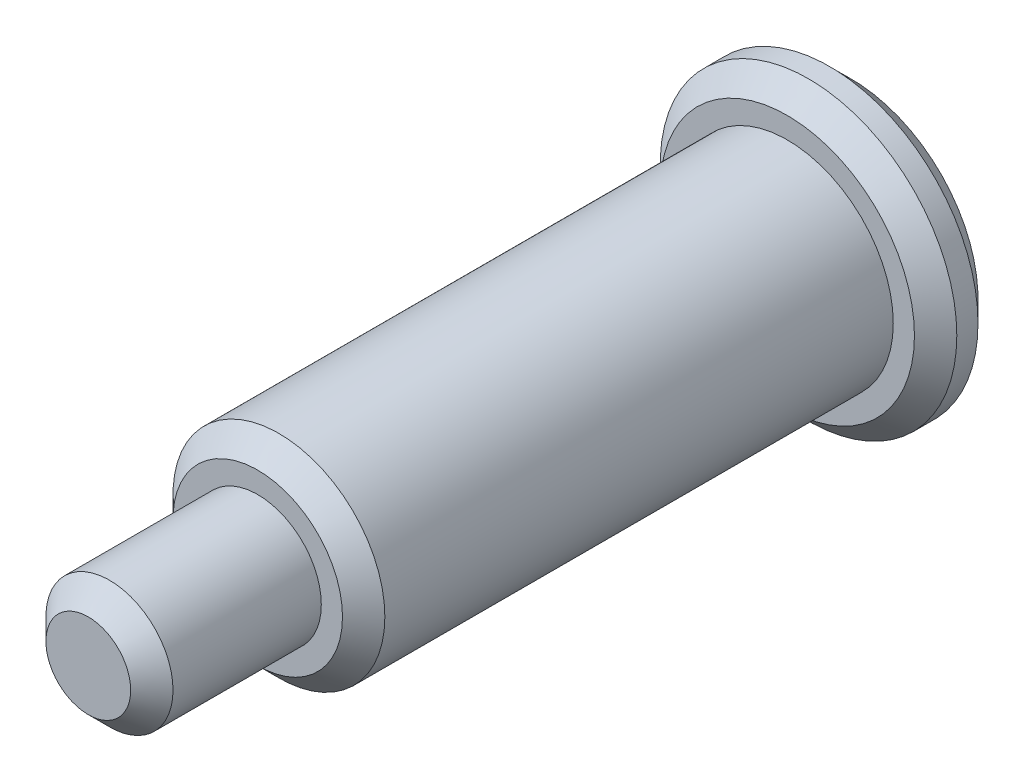
from build123d import *

# Parameters (mm, degrees)
CHAMFER1_SIZE = 1


with BuildPart() as part:
    # Sketch1 → Revolve1 (revolve)
    with BuildSketch(Plane(origin=(0, 0, 0), x_dir=(1, 0, 0), z_dir=(0, 1, 0))):
        Polygon((0, 0), (7, 0), (7, -3), (5, -3), (5, -28), (3, -28), (3, -36), (0, -36), align=None)
    revolve(axis=Axis((0, 0, 36), (0, 0, -1)))

    # Chamfer1
    chamfer1_edges = [part.edges().sort_by_distance(p)[0] for p in [
        (-3, 0, 36),
        (-5, 0, 28),
        (-7, 0, 0),
        (-7, 0, 3),
    ]]
    chamfer(chamfer1_edges, length=CHAMFER1_SIZE)


solid = part.part
